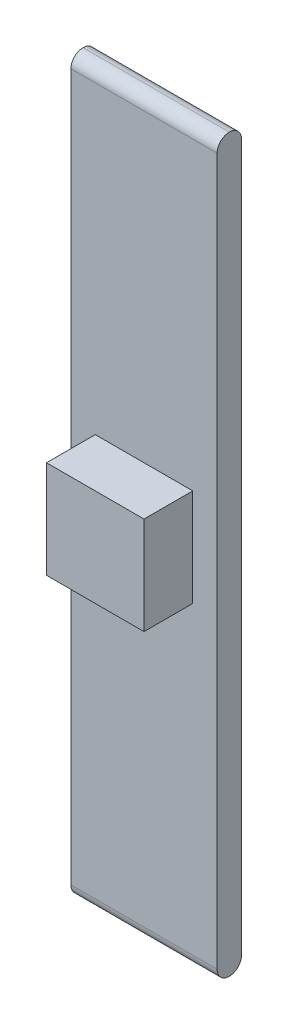
from build123d import *

# Parameters (mm, degrees)
SKETCH1_W           = 600
SKETCH1_H           = 3000
BOSS_EXTRUDE2_DEPTH = 100
FILLET2_R           = 50
SKETCH2_W           = 400
SKETCH2_H           = 400
BOSS_EXTRUDE3_DEPTH = 200


with BuildPart() as part:
    # Sketch1 → Boss-Extrude2 (new body)
    with BuildSketch(Plane.XY):
        Rectangle(SKETCH1_W, SKETCH1_H)
    extrude(amount=-BOSS_EXTRUDE2_DEPTH)

    # Fillet2
    fillet2_edges = [part.edges().sort_by_distance(p)[0] for p in [
        (0, 1500, -100),
        (0, 1500, 0),
        (0, -1500, -100),
        (0, -1500, 0),
    ]]
    fillet(fillet2_edges, radius=FILLET2_R - 0.0001)  # a hair under: the kernel refuses the full size

    # Sketch2 → Boss-Extrude3 (add)
    with BuildSketch(Plane.XY):
        Rectangle(SKETCH2_W, SKETCH2_H)
    extrude(amount=BOSS_EXTRUDE3_DEPTH)


solid = part.part
